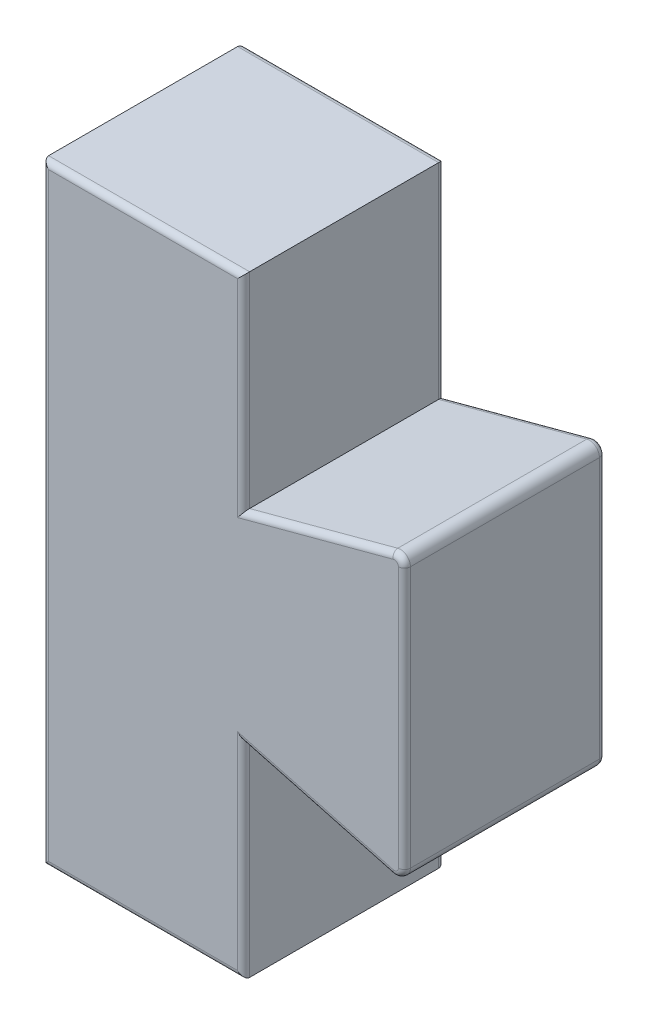
from build123d import *

# Parameters (mm, degrees)
BOSS_EXTRU_1_DEPTH = 10
CONG_1_R           = 0.3
CONG_2_R           = 0.5


with BuildPart() as part:
    # Esquisse1 → Boss.-Extru.1 (new body)
    with BuildSketch(Plane.XY):
        Polygon((10, 20.2), (18, 22.343593539), (18, 8.056406461), (10, 10.2), (10, 0), (0, 0), (0, 30.4), (10, 30.4), align=None)
    extrude(amount=BOSS_EXTRU_1_DEPTH)

    # Congé1
    cong_1_edges = [part.edges().sort_by_distance(p)[0] for p in [
        (14, 9.12820323, 0),
        (10, 5.1, 0),
        (5, 0, 0),
        (0, 15.2, 0),
        (10, 5.1, 10),
        (14, 9.12820323, 10),
        (18, 15.2, 10),
        (14, 21.27179677, 10),
        (10, 25.3, 10),
        (5, 30.4, 10),
        (0, 15.2, 10),
        (5, 30.4, 0),
        (5, 0, 10),
        (10, 25.3, 0),
        (14, 21.27179677, 0),
        (18, 15.2, 0),
    ]]
    fillet(cong_1_edges, radius=CONG_1_R)

    # Congé2
    # the kernel refuses this fillet: 0.5 mm, written as the material it takes off along each edge
    with BuildSketch(Plane(origin=(17.5, 21.691980853, 0), x_dir=(-0.25881904510251885, 0.9659258262890689, 0), z_dir=(-0.9659258262890689, -0.25881904510251885, 0))) as cong_2_piece_1:
        with BuildLine():
            CenterArc((0.2, -0.3), 0.3, 0, 90)
            Line((0.5, -0.3), (0.5, 0))
            Line((0.5, 0), (0.2, 0))
        make_face()
    revolve(axis=Axis((17.5, 21.691980853, 0), (0, 0, -1)), revolution_arc=105, mode=Mode.SUBTRACT)
    with BuildSketch(Plane(origin=(17.5, 8.708019147, 0), x_dir=(1, 0, 0), z_dir=(0, 1, 0))) as cong_2_piece_2:
        with BuildLine():
            CenterArc((0.2, -0.3), 0.3, 0, 90)
            Line((0.5, -0.3), (0.5, 0))
            Line((0.5, 0), (0.2, 0))
        make_face()
    revolve(axis=Axis((17.5, 8.708019147, 0), (0, 0, -1)), revolution_arc=105, mode=Mode.SUBTRACT)
    with BuildSketch(Plane(origin=(17.5, 8.708019147, 10), x_dir=(-0.25881904510251746, -0.9659258262890692, 0), z_dir=(-0.9659258262890692, 0.25881904510251746, 0))) as cong_2_piece_3:
        with BuildLine():
            CenterArc((0.2, -0.3), 0.3, 0, 90)
            Line((0.5, -0.3), (0.5, 0))
            Line((0.5, 0), (0.2, 0))
        make_face()
    revolve(axis=Axis((17.5, 8.708019147, 10), (0, 0, 1)), revolution_arc=105, mode=Mode.SUBTRACT)
    with BuildSketch(Plane(origin=(17.5, 21.691980853, 10), x_dir=(1, 0, 0), z_dir=(0, -1, 0))) as cong_2_piece_4:
        with BuildLine():
            CenterArc((0.2, -0.3), 0.3, 0, 90)
            Line((0.5, -0.3), (0.5, 0))
            Line((0.5, 0), (0.2, 0))
        make_face()
    revolve(axis=Axis((17.5, 21.691980853, 10), (0, 0, 1)), revolution_arc=105, mode=Mode.SUBTRACT)
    with BuildSketch(Plane(origin=(18, 8.056406461, 0), x_dir=(0, 1, 0), z_dir=(0, 0, 1)), Plane(origin=(18, 22.343593539, 0), x_dir=(-0.9659258262890698, -0.2588190451025152, 0), z_dir=(0, 0, 1))) as cong_2_piece_5:
        with BuildLine():
            CenterArc((CONG_2_R * 1.30322537284, CONG_2_R), CONG_2_R, 165, 105)
            Line((CONG_2_R * 0.337299546552, CONG_2_R * 1.2588190451), (0, 0))
            Line((0, 0), (CONG_2_R * 1.30322537284, 0))
        make_face()
    extrude(amount=10, mode=Mode.SUBTRACT)


solid = part.part
